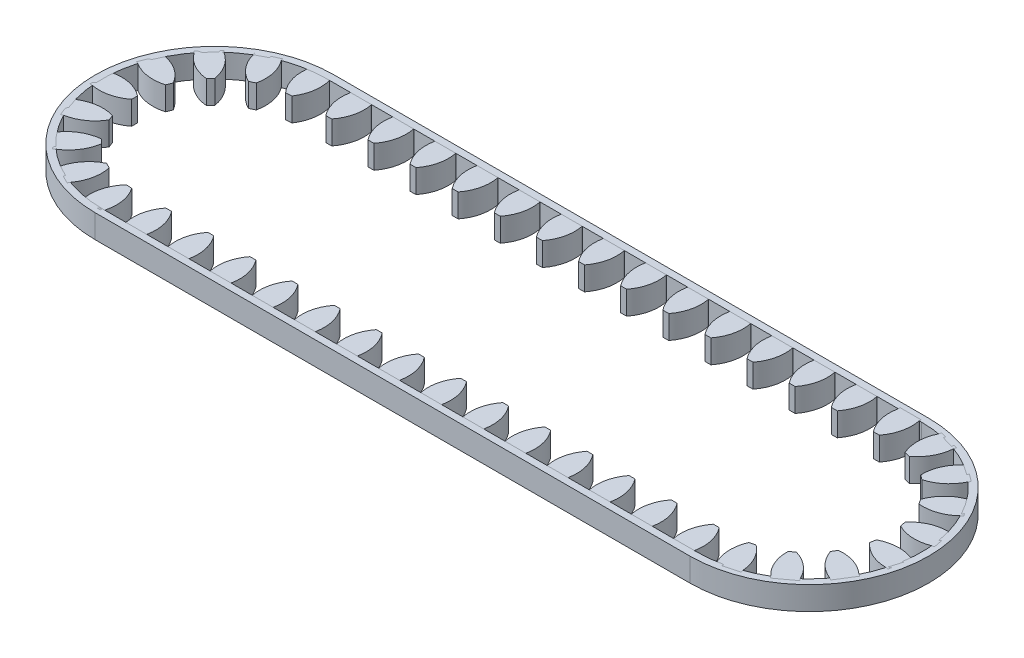
from build123d import *

# Parameters (mm, degrees)
BOSS_EXTRUDE1_DEPTH = 5
BOSS_EXTRUDE2_DEPTH = 5
CRVPATTERN1_DEPTH   = 5


# Read off the part's stored shape, not the designer's step: CrvPattern1
with BuildPart() as part:
    # Sketch1 → Boss-Extrude1 (new body)
    with BuildSketch(Plane(origin=(0, 0, 0), x_dir=(1, 0, 0), z_dir=(0, 1, 0))):
        with BuildLine():
            Line((0, 25.5), (127, 25.5))
            ThreePointArc((127, 25.5), (152.5, 0), (127, -25.5))
            Line((127, -25.5), (0, -25.5))
            ThreePointArc((0, -25.5), (-25.5, 0), (0, 25.5))
        make_face()
        with BuildLine():
            Line((0, -24), (127, -24))
            ThreePointArc((127, -24), (151, 0), (127, 24))
            add(Edge.make_bspline(
                [(0, 24), (63.5, 24), (127, 24)],
                knots=[0, 0, 0, 1, 1, 1], degree=2))
            ThreePointArc((0, 24), (-24, 0), (0, -24))
        make_face(mode=Mode.SUBTRACT)
    extrude(amount=BOSS_EXTRUDE1_DEPTH)


with BuildPart() as body_2:
    # Sketch4 → Boss-Extrude2 (new body)
    with BuildSketch(Plane(origin=(0, 0, 0), x_dir=(-1, 0, 0), z_dir=(0, -1, 0))):
        with BuildLine():
            ThreePointArc((17.101526887, -0.635252012), (20.322077388, -2.182192533), (23.894229865, -2.250728579))
            ThreePointArc((23.894229865, -2.250728579), (24, 0), (23.894229865, 2.250728579))
            ThreePointArc((23.894229865, 2.250728579), (20.322077388, 2.182192533), (17.101526887, 0.635252012))
            ThreePointArc((17.101526887, 0.635252012), (17.093118224, 0), (17.101526887, -0.635252012))
        make_face()
        with BuildLine():
            ThreePointArc((23.894229865, 2.250728579), (24, 0), (23.894229865, -2.250728579))
            Line((23.894229865, -2.250728579), (24.394229865, -2.250728579))
            Line((24.394229865, -2.250728579), (24.394229865, 2.250728579))
            Line((24.394229865, 2.250728579), (23.894229865, 2.250728579))
        make_face()
    extrude(amount=-BOSS_EXTRUDE2_DEPTH)


with BuildPart() as body_3:
    # CrvPattern1 outline → CrvPattern1 (new body)
    with BuildSketch(Plane(origin=(0, 0, 0), x_dir=(1, 0, 0), z_dir=(0, 1, 0))):
        with BuildLine():
            ThreePointArc((-21.411521988, -10.841896796), (-18.112439153, -9.470392893), (-15.681777613, -6.851833178))
            ThreePointArc((-15.681777613, -6.851833178), (-15.906511438, -6.257602135), (-16.146895129, -5.66952773))
            ThreePointArc((-16.146895129, -5.66952773), (-19.71019241, -5.408984081), (-23.059455827, -6.652931457))
            Line((-23.059455827, -6.652931457), (-23.524745753, -6.835975945))
            Line((-23.524745753, -6.835975945), (-21.876811915, -11.024941284))
            Line((-21.876811915, -11.024941284), (-21.411521988, -10.841896796))
        make_face()
        with BuildLine():
            ThreePointArc((-15.955637099, -17.928124408), (-13.387724268, -15.444016076), (-12.084498745, -12.117370055))
            ThreePointArc((-12.084498745, -12.117370055), (-12.51118332, -11.646672596), (-12.950177213, -11.187433894))
            ThreePointArc((-12.950177213, -11.187433894), (-16.361468631, -12.249536231), (-19.022777748, -14.633315645))
            Line((-19.022777748, -14.633315645), (-19.388749104, -14.973998733))
            Line((-19.388749104, -14.973998733), (-16.321608455, -18.268807496))
            Line((-16.321608455, -18.268807496), (-15.955637099, -17.928124408))
        make_face()
        with BuildLine():
            ThreePointArc((-8.284973642, -22.524635663), (-6.804691695, -19.272907527), (-6.809742217, -15.700101207))
            ThreePointArc((-6.809742217, -15.700101207), (-7.379120084, -15.418277381), (-7.955758011, -15.151623064))
            ThreePointArc((-7.955758011, -15.151623064), (-10.741439728, -17.388797147), (-12.345362985, -20.581351092))
            Line((-12.345362985, -20.581351092), (-12.561213598, -21.032359421))
            Line((-12.561213598, -21.032359421), (-8.500824254, -22.975643992))
            Line((-8.500824254, -22.975643992), (-8.284973642, -22.524635663))
        make_face()
        with BuildLine():
            ThreePointArc((0.536682309, -23.993998668), (0.723708022, -20.426087249), (-0.589024905, -17.103181477))
            ThreePointArc((-0.589024905, -17.103181477), (-1.222050174, -17.049377818), (-1.856277775, -17.012348451))
            ThreePointArc((-1.856277775, -17.012348451), (-3.629508809, -20.114061237), (-3.953255853, -23.672172865))
            Line((-3.953255853, -23.672172865), (-3.9890027, -24.170893391))
            Line((-3.9890027, -24.170893391), (0.500935462, -24.492719194))
            Line((0.500935462, -24.492719194), (0.536682309, -23.993998668))
        make_face()
        with BuildLine():
            ThreePointArc((9.528761157, -23.894229865), (9.460225111, -20.322077388), (7.913284589, -17.101526887))
            ThreePointArc((7.913284589, -17.101526887), (7.278032577, -17.093118224), (6.642780566, -17.101526887))
            ThreePointArc((6.642780566, -17.101526887), (5.095840044, -20.322077388), (5.027303999, -23.894229865))
            Line((5.027303999, -23.894229865), (5.027303999, -24.394229865))
            Line((5.027303999, -24.394229865), (9.528761157, -24.394229865))
            Line((9.528761157, -24.394229865), (9.528761157, -23.894229865))
        make_face()
        with BuildLine():
            Line((9.528761157, 24.394229865), (5.027303999, 24.394229865))
            Line((5.027303999, 24.394229865), (5.027303999, 23.894229865))
            ThreePointArc((5.027303999, 23.894229865), (5.095840045, 20.322077388), (6.642780566, 17.101526887))
            ThreePointArc((6.642780566, 17.101526887), (7.278032578, 17.093118224), (7.91328459, 17.101526887))
            ThreePointArc((7.91328459, 17.101526887), (9.460225111, 20.322077388), (9.528761157, 23.894229865))
            Line((9.528761157, 23.894229865), (9.528761157, 24.394229865))
        make_face()
        with BuildLine():
            Line((14.023086797, -23.894229865), (14.023086797, -24.394229865))
            Line((14.023086797, -24.394229865), (18.524543955, -24.394229865))
            Line((18.524543955, -24.394229865), (18.524543955, -23.894229865))
            ThreePointArc((18.524543955, -23.894229865), (18.456007909, -20.322077388), (16.909067388, -17.101526887))
            ThreePointArc((16.909067388, -17.101526887), (16.273815376, -17.093118224), (15.638563364, -17.101526887))
            ThreePointArc((15.638563364, -17.101526887), (14.091622843, -20.322077388), (14.023086797, -23.894229865))
        make_face()
        with BuildLine():
            Line((23.017529541, -23.894229865), (23.017529541, -24.394229865))
            Line((23.017529541, -24.394229865), (27.518986699, -24.394229865))
            Line((27.518986699, -24.394229865), (27.518986699, -23.894229865))
            ThreePointArc((27.518986699, -23.894229865), (27.450450654, -20.322077388), (25.903510132, -17.101526887))
            ThreePointArc((25.903510132, -17.101526887), (25.26825812, -17.093118224), (24.633006108, -17.101526887))
            ThreePointArc((24.633006108, -17.101526887), (23.086065587, -20.322077388), (23.017529541, -23.894229865))
        make_face()
        with BuildLine():
            Line((32.014652394, -23.894229865), (32.014652394, -24.394229865))
            Line((32.014652394, -24.394229865), (36.516109552, -24.394229865))
            Line((36.516109552, -24.394229865), (36.516109552, -23.894229865))
            ThreePointArc((36.516109552, -23.894229865), (36.447573506, -20.322077388), (34.900632985, -17.101526887))
            ThreePointArc((34.900632985, -17.101526887), (34.265380973, -17.093118224), (33.630128961, -17.101526887))
            ThreePointArc((33.630128961, -17.101526887), (32.083188439, -20.322077388), (32.014652394, -23.894229865))
        make_face()
        with BuildLine():
            Line((41.009095138, -23.894229865), (41.009095138, -24.394229865))
            Line((41.009095138, -24.394229865), (45.510552296, -24.394229865))
            Line((45.510552296, -24.394229865), (45.510552296, -23.894229865))
            ThreePointArc((45.510552296, -23.894229865), (45.44201625, -20.322077388), (43.895075729, -17.101526887))
            ThreePointArc((43.895075729, -17.101526887), (43.259823717, -17.093118224), (42.624571705, -17.101526887))
            ThreePointArc((42.624571705, -17.101526887), (41.077631184, -20.322077388), (41.009095138, -23.894229865))
        make_face()
        with BuildLine():
            Line((50.004877936, -23.894229865), (50.004877936, -24.394229865))
            Line((50.004877936, -24.394229865), (54.506335095, -24.394229865))
            Line((54.506335095, -24.394229865), (54.506335095, -23.894229865))
            ThreePointArc((54.506335095, -23.894229865), (54.437799049, -20.322077388), (52.890858527, -17.101526887))
            ThreePointArc((52.890858527, -17.101526887), (52.255606515, -17.093118224), (51.620354504, -17.101526887))
            ThreePointArc((51.620354504, -17.101526887), (50.073413982, -20.322077388), (50.004877936, -23.894229865))
        make_face()
        with BuildLine():
            Line((59.000660735, -23.894229865), (59.000660735, -24.394229865))
            Line((59.000660735, -24.394229865), (63.502117893, -24.394229865))
            Line((63.502117893, -24.394229865), (63.502117893, -23.894229865))
            ThreePointArc((63.502117893, -23.894229865), (63.433581847, -20.322077388), (61.886641326, -17.101526887))
            ThreePointArc((61.886641326, -17.101526887), (61.251389314, -17.093118224), (60.616137302, -17.101526887))
            ThreePointArc((60.616137302, -17.101526887), (59.069196781, -20.322077388), (59.000660735, -23.894229865))
        make_face()
        with BuildLine():
            Line((67.995103479, -23.894229865), (67.995103479, -24.394229865))
            Line((67.995103479, -24.394229865), (72.496560637, -24.394229865))
            Line((72.496560637, -24.394229865), (72.496560637, -23.894229865))
            ThreePointArc((72.496560637, -23.894229865), (72.428024591, -20.322077388), (70.88108407, -17.101526887))
            ThreePointArc((70.88108407, -17.101526887), (70.245832058, -17.093118224), (69.610580046, -17.101526887))
            ThreePointArc((69.610580046, -17.101526887), (68.063639525, -20.322077388), (67.995103479, -23.894229865))
        make_face()
        with BuildLine():
            Line((76.992226331, -23.894229865), (76.992226331, -24.394229865))
            Line((76.992226331, -24.394229865), (81.49368349, -24.394229865))
            Line((81.49368349, -24.394229865), (81.49368349, -23.894229865))
            ThreePointArc((81.49368349, -23.894229865), (81.425147444, -20.322077388), (79.878206922, -17.101526887))
            ThreePointArc((79.878206922, -17.101526887), (79.242954911, -17.093118224), (78.607702899, -17.101526887))
            ThreePointArc((78.607702899, -17.101526887), (77.060762377, -20.322077388), (76.992226331, -23.894229865))
        make_face()
        with BuildLine():
            Line((85.986669076, -23.894229865), (85.986669076, -24.394229865))
            Line((85.986669076, -24.394229865), (90.488126234, -24.394229865))
            Line((90.488126234, -24.394229865), (90.488126234, -23.894229865))
            ThreePointArc((90.488126234, -23.894229865), (90.419590188, -20.322077388), (88.872649667, -17.101526887))
            ThreePointArc((88.872649667, -17.101526887), (88.237397655, -17.093118224), (87.602145643, -17.101526887))
            ThreePointArc((87.602145643, -17.101526887), (86.055205122, -20.322077388), (85.986669076, -23.894229865))
        make_face()
        with BuildLine():
            Line((94.982451874, -23.894229865), (94.982451874, -24.394229865))
            Line((94.982451874, -24.394229865), (99.483909032, -24.394229865))
            Line((99.483909032, -24.394229865), (99.483909032, -23.894229865))
            ThreePointArc((99.483909032, -23.894229865), (99.415372986, -20.322077388), (97.868432465, -17.101526887))
            ThreePointArc((97.868432465, -17.101526887), (97.233180453, -17.093118224), (96.597928441, -17.101526887))
            ThreePointArc((96.597928441, -17.101526887), (95.05098792, -20.322077388), (94.982451874, -23.894229865))
        make_face()
        with BuildLine():
            Line((103.978234673, -23.894229865), (103.978234673, -24.394229865))
            Line((103.978234673, -24.394229865), (108.479691831, -24.394229865))
            Line((108.479691831, -24.394229865), (108.479691831, -23.894229865))
            ThreePointArc((108.479691831, -23.894229865), (108.411155785, -20.322077388), (106.864215263, -17.101526887))
            ThreePointArc((106.864215263, -17.101526887), (106.228963252, -17.093118224), (105.59371124, -17.101526887))
            ThreePointArc((105.59371124, -17.101526887), (104.046770718, -20.322077388), (103.978234673, -23.894229865))
        make_face()
        with BuildLine():
            Line((112.972677417, -23.894229865), (112.972677417, -24.394229865))
            Line((112.972677417, -24.394229865), (117.474134575, -24.394229865))
            Line((117.474134575, -24.394229865), (117.474134575, -23.894229865))
            ThreePointArc((117.474134575, -23.894229865), (117.405598529, -20.322077388), (115.858658008, -17.101526887))
            ThreePointArc((115.858658008, -17.101526887), (115.223405996, -17.093118224), (114.588153984, -17.101526887))
            ThreePointArc((114.588153984, -17.101526887), (113.041213463, -20.322077388), (112.972677417, -23.894229865))
        make_face()
        with BuildLine():
            Line((121.968460215, -23.894229865), (121.968460215, -24.394229865))
            Line((121.968460215, -24.394229865), (126.469917373, -24.394229865))
            Line((126.469917373, -24.394229865), (126.469917373, -23.894229865))
            ThreePointArc((126.469917373, -23.894229865), (126.401381328, -20.322077388), (124.854440806, -17.101526887))
            ThreePointArc((124.854440806, -17.101526887), (124.219188794, -17.093118224), (123.583936782, -17.101526887))
            ThreePointArc((123.583936782, -17.101526887), (122.036996261, -20.322077388), (121.968460215, -23.894229865))
        make_face()
        with BuildLine():
            Line((18.524543955, 24.394229865), (14.023086797, 24.394229865))
            Line((14.023086797, 24.394229865), (14.023086797, 23.894229865))
            ThreePointArc((14.023086797, 23.894229865), (14.091622843, 20.322077388), (15.638563365, 17.101526887))
            ThreePointArc((15.638563365, 17.101526887), (16.273815376, 17.093118224), (16.909067388, 17.101526887))
            ThreePointArc((16.909067388, 17.101526887), (18.45600791, 20.322077388), (18.524543955, 23.894229865))
            Line((18.524543955, 23.894229865), (18.524543955, 24.394229865))
        make_face()
        with BuildLine():
            Line((27.5189867, 24.394229865), (23.017529541, 24.394229865))
            Line((23.017529541, 24.394229865), (23.017529541, 23.894229865))
            ThreePointArc((23.017529541, 23.894229865), (23.086065587, 20.322077388), (24.633006109, 17.101526887))
            ThreePointArc((24.633006109, 17.101526887), (25.268258121, 17.093118224), (25.903510132, 17.101526887))
            ThreePointArc((25.903510132, 17.101526887), (27.450450654, 20.322077388), (27.5189867, 23.894229865))
            Line((27.5189867, 23.894229865), (27.5189867, 24.394229865))
        make_face()
        with BuildLine():
            Line((36.516109552, 24.394229865), (32.014652394, 24.394229865))
            Line((32.014652394, 24.394229865), (32.014652394, 23.894229865))
            ThreePointArc((32.014652394, 23.894229865), (32.08318844, 20.322077388), (33.630128961, 17.101526887))
            ThreePointArc((33.630128961, 17.101526887), (34.265380973, 17.093118224), (34.900632985, 17.101526887))
            ThreePointArc((34.900632985, 17.101526887), (36.447573506, 20.322077388), (36.516109552, 23.894229865))
            Line((36.516109552, 23.894229865), (36.516109552, 24.394229865))
        make_face()
        with BuildLine():
            Line((45.510552296, 24.394229865), (41.009095138, 24.394229865))
            Line((41.009095138, 24.394229865), (41.009095138, 23.894229865))
            ThreePointArc((41.009095138, 23.894229865), (41.077631184, 20.322077388), (42.624571706, 17.101526887))
            ThreePointArc((42.624571706, 17.101526887), (43.259823717, 17.093118224), (43.895075729, 17.101526887))
            ThreePointArc((43.895075729, 17.101526887), (45.442016251, 20.322077388), (45.510552296, 23.894229865))
            Line((45.510552296, 23.894229865), (45.510552296, 24.394229865))
        make_face()
        with BuildLine():
            Line((54.506335095, 24.394229865), (50.004877937, 24.394229865))
            Line((50.004877937, 24.394229865), (50.004877937, 23.894229865))
            ThreePointArc((50.004877937, 23.894229865), (50.073413982, 20.322077388), (51.620354504, 17.101526887))
            ThreePointArc((51.620354504, 17.101526887), (52.255606516, 17.093118224), (52.890858528, 17.101526887))
            ThreePointArc((52.890858528, 17.101526887), (54.437799049, 20.322077388), (54.506335095, 23.894229865))
            Line((54.506335095, 23.894229865), (54.506335095, 24.394229865))
        make_face()
        with BuildLine():
            Line((63.502117893, 24.394229865), (59.000660735, 24.394229865))
            Line((59.000660735, 24.394229865), (59.000660735, 23.894229865))
            ThreePointArc((59.000660735, 23.894229865), (59.069196781, 20.322077388), (60.616137302, 17.101526887))
            ThreePointArc((60.616137302, 17.101526887), (61.251389314, 17.093118224), (61.886641326, 17.101526887))
            ThreePointArc((61.886641326, 17.101526887), (63.433581847, 20.322077388), (63.502117893, 23.894229865))
            Line((63.502117893, 23.894229865), (63.502117893, 24.394229865))
        make_face()
        with BuildLine():
            Line((72.496560637, 24.394229865), (67.995103479, 24.394229865))
            Line((67.995103479, 24.394229865), (67.995103479, 23.894229865))
            ThreePointArc((67.995103479, 23.894229865), (68.063639525, 20.322077388), (69.610580047, 17.101526887))
            ThreePointArc((69.610580047, 17.101526887), (70.245832058, 17.093118224), (70.88108407, 17.101526887))
            ThreePointArc((70.88108407, 17.101526887), (72.428024592, 20.322077388), (72.496560637, 23.894229865))
            Line((72.496560637, 23.894229865), (72.496560637, 24.394229865))
        make_face()
        with BuildLine():
            Line((81.49368349, 24.394229865), (76.992226332, 24.394229865))
            Line((76.992226332, 24.394229865), (76.992226332, 23.894229865))
            ThreePointArc((76.992226332, 23.894229865), (77.060762377, 20.322077388), (78.607702899, 17.101526887))
            ThreePointArc((78.607702899, 17.101526887), (79.242954911, 17.093118224), (79.878206923, 17.101526887))
            ThreePointArc((79.878206923, 17.101526887), (81.425147444, 20.322077388), (81.49368349, 23.894229865))
            Line((81.49368349, 23.894229865), (81.49368349, 24.394229865))
        make_face()
        with BuildLine():
            Line((90.488126234, 24.394229865), (85.986669076, 24.394229865))
            Line((85.986669076, 24.394229865), (85.986669076, 23.894229865))
            ThreePointArc((85.986669076, 23.894229865), (86.055205122, 20.322077388), (87.602145643, 17.101526887))
            ThreePointArc((87.602145643, 17.101526887), (88.237397655, 17.093118224), (88.872649667, 17.101526887))
            ThreePointArc((88.872649667, 17.101526887), (90.419590188, 20.322077388), (90.488126234, 23.894229865))
            Line((90.488126234, 23.894229865), (90.488126234, 24.394229865))
        make_face()
        with BuildLine():
            Line((99.483909032, 24.394229865), (94.982451874, 24.394229865))
            Line((94.982451874, 24.394229865), (94.982451874, 23.894229865))
            ThreePointArc((94.982451874, 23.894229865), (95.05098792, 20.322077388), (96.597928442, 17.101526887))
            ThreePointArc((96.597928442, 17.101526887), (97.233180453, 17.093118224), (97.868432465, 17.101526887))
            ThreePointArc((97.868432465, 17.101526887), (99.415372987, 20.322077388), (99.483909032, 23.894229865))
            Line((99.483909032, 23.894229865), (99.483909032, 24.394229865))
        make_face()
        with BuildLine():
            Line((108.479691831, 24.394229865), (103.978234673, 24.394229865))
            Line((103.978234673, 24.394229865), (103.978234673, 23.894229865))
            ThreePointArc((103.978234673, 23.894229865), (104.046770718, 20.322077388), (105.59371124, 17.101526887))
            ThreePointArc((105.59371124, 17.101526887), (106.228963252, 17.093118224), (106.864215264, 17.101526887))
            ThreePointArc((106.864215264, 17.101526887), (108.411155785, 20.322077388), (108.479691831, 23.894229865))
            Line((108.479691831, 23.894229865), (108.479691831, 24.394229865))
        make_face()
        with BuildLine():
            Line((117.474134575, 24.394229865), (112.972677417, 24.394229865))
            Line((112.972677417, 24.394229865), (112.972677417, 23.894229865))
            ThreePointArc((112.972677417, 23.894229865), (113.041213463, 20.322077388), (114.588153984, 17.101526887))
            ThreePointArc((114.588153984, 17.101526887), (115.223405996, 17.093118224), (115.858658008, 17.101526887))
            ThreePointArc((115.858658008, 17.101526887), (117.405598529, 20.322077388), (117.474134575, 23.894229865))
            Line((117.474134575, 23.894229865), (117.474134575, 24.394229865))
        make_face()
        with BuildLine():
            Line((126.469917373, 24.394229865), (121.968460215, 24.394229865))
            Line((121.968460215, 24.394229865), (121.968460215, 23.894229865))
            ThreePointArc((121.968460215, 23.894229865), (122.036996261, 20.322077388), (123.583936783, 17.101526887))
            ThreePointArc((123.583936783, 17.101526887), (124.219188794, 17.093118224), (124.854440806, 17.101526887))
            ThreePointArc((124.854440806, 17.101526887), (126.401381328, 20.322077388), (126.469917373, 23.894229865))
            Line((126.469917373, 23.894229865), (126.469917373, 24.394229865))
        make_face()
        with BuildLine():
            ThreePointArc((135.294570643, -22.521103389), (134.313554406, -19.08561541), (131.993470265, -16.368598648))
            ThreePointArc((131.993470265, -16.368598648), (131.377247455, -16.523147259), (130.765331267, -16.693952421))
            ThreePointArc((130.765331267, -16.693952421), (130.094699999, -20.203257795), (130.943214821, -23.67384753))
            Line((130.943214821, -23.67384753), (131.071256042, -24.157175003))
            Line((131.071256042, -24.157175003), (135.422611864, -23.004430861))
            Line((135.422611864, -23.004430861), (135.294570643, -22.521103389))
        make_face()
        with BuildLine():
            ThreePointArc((142.964123766, -17.920567859), (140.79341487, -15.082788199), (137.639661864, -13.403856252))
            ThreePointArc((137.639661864, -13.403856252), (137.122808981, -13.773286788), (136.615915578, -14.156268384))
            ThreePointArc((136.615915578, -14.156268384), (137.276682206, -17.667444537), (139.336941201, -20.586400409))
            Line((139.336941201, -20.586400409), (139.633048934, -20.989290233))
            Line((139.633048934, -20.989290233), (143.260231499, -18.323457683))
            Line((143.260231499, -18.323457683), (142.964123766, -17.920567859))
        make_face()
        with BuildLine():
            ThreePointArc((148.416461403, -10.832136492), (145.357555557, -8.986041821), (141.808096298, -8.578231229))
            ThreePointArc((141.808096298, -8.578231229), (141.462370184, -9.11123149), (141.130873095, -9.653195976))
            ThreePointArc((141.130873095, -9.653195976), (143.031185252, -12.678718115), (146.017026866, -14.640788544))
            Line((146.017026866, -14.640788544), (146.440073439, -14.90730608))
            Line((146.440073439, -14.90730608), (148.839507976, -11.098654028))
            Line((148.839507976, -11.098654028), (148.416461403, -10.832136492))
        make_face()
        with BuildLine():
            ThreePointArc((150.895158794, -2.240844979), (147.372792955, -1.642589677), (143.920403939, -2.562361709))
            ThreePointArc((143.920403939, -2.562361709), (143.793777456, -3.184922194), (143.683673788, -3.810616214))
            ThreePointArc((143.683673788, -3.810616214), (146.559586922, -5.93054408), (150.056412427, -6.663471018))
            Line((150.056412427, -6.663471018), (150.547656249, -6.756634891))
            Line((150.547656249, -6.756634891), (151.386402616, -2.334008852))
            Line((151.386402616, -2.334008852), (150.895158794, -2.240844979))
        make_face()
        with BuildLine():
            ThreePointArc((150.056412427, 6.663471018), (146.559586922, 5.930544079), (143.683673788, 3.810616214))
            ThreePointArc((143.683673788, 3.810616214), (143.793777456, 3.184922194), (143.920403939, 2.562361709))
            ThreePointArc((143.920403939, 2.562361709), (147.372792955, 1.642589677), (150.895158794, 2.240844979))
            Line((150.895158794, 2.240844979), (151.386402616, 2.334008852))
            Line((151.386402616, 2.334008852), (150.547656249, 6.756634891))
            Line((150.547656249, 6.756634891), (150.056412427, 6.663471018))
        make_face()
        with BuildLine():
            ThreePointArc((146.017026866, 14.640788544), (143.031185252, 12.678718115), (141.130873095, 9.653195976))
            ThreePointArc((141.130873095, 9.653195976), (141.462370185, 9.11123149), (141.808096298, 8.578231228))
            ThreePointArc((141.808096298, 8.578231228), (145.357555557, 8.986041821), (148.416461403, 10.832136492))
            Line((148.416461403, 10.832136492), (148.839507976, 11.098654028))
            Line((148.839507976, 11.098654028), (146.440073439, 14.907306079))
            Line((146.440073439, 14.907306079), (146.017026866, 14.640788544))
        make_face()
        with BuildLine():
            ThreePointArc((139.336941201, 20.586400409), (137.276682207, 17.667444536), (136.615915579, 14.156268384))
            ThreePointArc((136.615915579, 14.156268384), (137.122808981, 13.773286788), (137.639661864, 13.403856251))
            ThreePointArc((137.639661864, 13.403856251), (140.79341487, 15.082788199), (142.964123766, 17.920567859))
            Line((142.964123766, 17.920567859), (143.260231499, 18.323457683))
            Line((143.260231499, 18.323457683), (139.633048934, 20.989290233))
            Line((139.633048934, 20.989290233), (139.336941201, 20.586400409))
        make_face()
        with BuildLine():
            ThreePointArc((130.943214821, 23.67384753), (130.094699999, 20.203257795), (130.765331268, 16.693952421))
            ThreePointArc((130.765331268, 16.693952421), (131.377247456, 16.523147259), (131.993470265, 16.368598648))
            ThreePointArc((131.993470265, 16.368598648), (134.313554406, 19.08561541), (135.294570643, 22.521103389))
            Line((135.294570643, 22.521103389), (135.422611864, 23.004430861))
            Line((135.422611864, 23.004430861), (131.071256042, 24.157175003))
            Line((131.071256042, 24.157175003), (130.943214821, 23.67384753))
        make_face()
        with BuildLine():
            ThreePointArc((-3.953255853, 23.672172865), (-3.629508809, 20.114061237), (-1.856277775, 17.012348451))
            ThreePointArc((-1.856277775, 17.012348451), (-1.222050174, 17.049377818), (-0.589024905, 17.103181477))
            ThreePointArc((-0.589024905, 17.103181477), (0.723708022, 20.426087249), (0.536682309, 23.993998668))
            Line((0.536682309, 23.993998668), (0.500935462, 24.492719194))
            Line((0.500935462, 24.492719194), (-3.9890027, 24.170893391))
            Line((-3.9890027, 24.170893391), (-3.953255853, 23.672172865))
        make_face()
        with BuildLine():
            ThreePointArc((-12.345362985, 20.581351092), (-10.741439729, 17.388797146), (-7.955758011, 15.151623063))
            ThreePointArc((-7.955758011, 15.151623063), (-7.379120084, 15.418277381), (-6.809742217, 15.700101207))
            ThreePointArc((-6.809742217, 15.700101207), (-6.804691695, 19.272907527), (-8.284973642, 22.524635663))
            Line((-8.284973642, 22.524635663), (-8.500824255, 22.975643992))
            Line((-8.500824255, 22.975643992), (-12.561213598, 21.032359421))
            Line((-12.561213598, 21.032359421), (-12.345362985, 20.581351092))
        make_face()
        with BuildLine():
            ThreePointArc((-19.022777748, 14.633315645), (-16.361468631, 12.249536231), (-12.950177213, 11.187433894))
            ThreePointArc((-12.950177213, 11.187433894), (-12.51118332, 11.646672596), (-12.084498745, 12.117370055))
            ThreePointArc((-12.084498745, 12.117370055), (-13.387724268, 15.444016076), (-15.955637099, 17.928124408))
            Line((-15.955637099, 17.928124408), (-16.321608455, 18.268807496))
            Line((-16.321608455, 18.268807496), (-19.388749104, 14.973998733))
            Line((-19.388749104, 14.973998733), (-19.022777748, 14.633315645))
        make_face()
        with BuildLine():
            ThreePointArc((-23.059455827, 6.652931457), (-19.71019241, 5.408984081), (-16.146895129, 5.66952773))
            ThreePointArc((-16.146895129, 5.66952773), (-15.906511438, 6.257602135), (-15.681777613, 6.851833178))
            ThreePointArc((-15.681777613, 6.851833178), (-18.112439153, 9.470392893), (-21.411521988, 10.841896796))
            Line((-21.411521988, 10.841896796), (-21.876811915, 11.024941284))
            Line((-21.876811915, 11.024941284), (-23.524745753, 6.835975945))
            Line((-23.524745753, 6.835975945), (-23.059455827, 6.652931457))
        make_face()
    extrude(amount=CRVPATTERN1_DEPTH)


solid = Compound([part.part, body_2.part, body_3.part])
